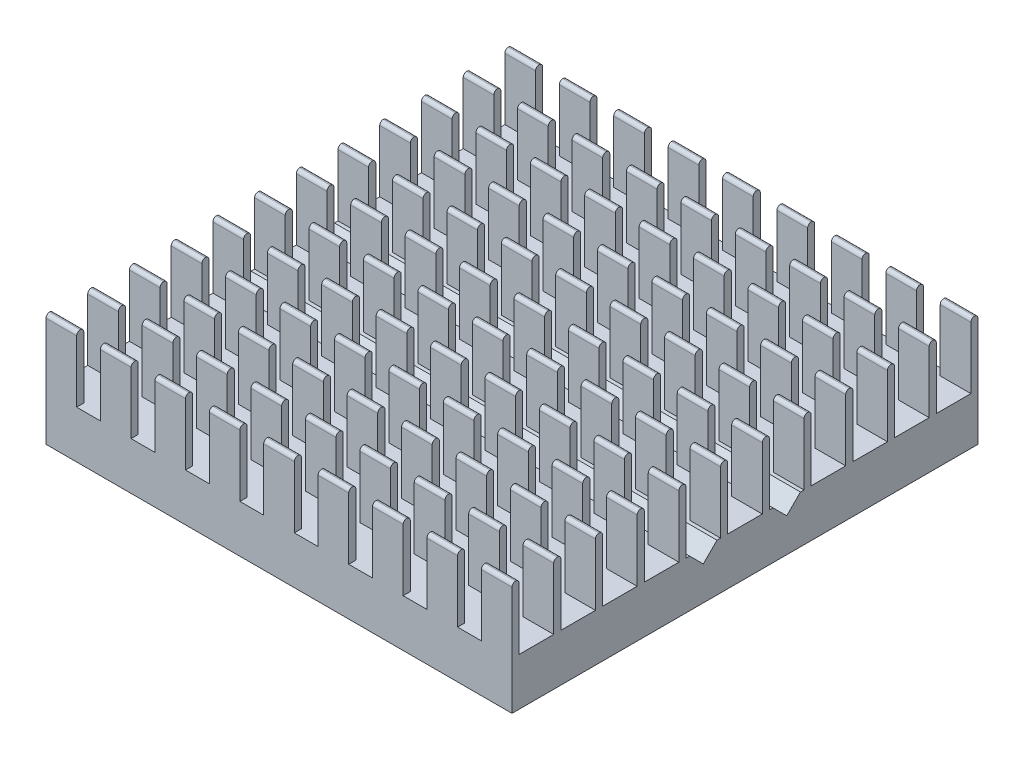
from build123d import *

# Parameters (mm, degrees)
BOSS_EXTRUDE1_START     = -4.75
SKETCH3_W               = 39.25
SKETCH3_H               = 39.25
BOSS_EXTRUDE1_DEPTH     = 4
BOSS_EXTRUDE2_START     = -0.75
SKETCH4_W               = 2.58
SKETCH4_H               = 0.6
BOSS_EXTRUDE2_DEPTH     = 5.5
FILLET1_R               = 0.3
LPATTERN1_START         = -15.04125
LPATTERN1_DEPTH         = 2.58
LPATTERN1_START_2       = -10.4575
LPATTERN1_2_DEPTH       = 2.58
LPATTERN1_START_3       = -5.87375
LPATTERN1_3_DEPTH       = 2.58
LPATTERN1_START_4       = -1.29
LPATTERN1_4_DEPTH       = 2.58
LPATTERN1_START_5       = 3.29375
LPATTERN1_5_DEPTH       = 2.58
LPATTERN1_START_6       = 7.8775
LPATTERN1_6_DEPTH       = 2.58
LPATTERN1_START_7       = 12.46125
LPATTERN1_7_DEPTH       = 2.58
LPATTERN1_START_8       = 17.045
LPATTERN1_8_DEPTH       = 2.58
LPATTERN1_START_9       = -19.625
LPATTERN1_9_DEPTH       = 2.58
CUT_EXTRUDE1_DEPTH      = 29.157481244
CUT_EXTRUDE1_DEPTH_BACK = 29.157481244


# Read off the part's stored shape, not the designer's step: LPattern1
with BuildPart() as part:
    # Sketch3 → Boss-Extrude1 (new body)
    with BuildSketch(Plane(origin=(0, 0, 0), x_dir=(1, 0, 0), z_dir=(0, 1, 0)).offset(BOSS_EXTRUDE1_START)):
        Rectangle(SKETCH3_W, SKETCH3_H)
    extrude(amount=BOSS_EXTRUDE1_DEPTH)

    # Sketch4 → Boss-Extrude2 (add)
    with BuildSketch(Plane(origin=(0, 0, 0), x_dir=(1, 0, 0), z_dir=(0, 1, 0)).offset(BOSS_EXTRUDE2_START)):
        with Locations((-18.335, -19.325)):
            Rectangle(SKETCH4_W, SKETCH4_H)
    extrude(amount=BOSS_EXTRUDE2_DEPTH)

    # Fillet1
    fillet1_edges = [part.edges().sort_by_distance(p)[0] for p in [
        (-18.335, 4.75, 19.025),
        (-18.335, 4.75, 19.625),
    ]]
    fillet(fillet1_edges, radius=FILLET1_R - 0.0001)  # a hair under: the kernel refuses the full size

    # LPattern1 outline → LPattern1 (add)
    with BuildSketch(Plane.YZ.offset(LPATTERN1_START)):
        with BuildLine():
            Line((4.45, -19.025), (-0.75, -19.025))
            Line((-0.75, -19.025), (-0.75, -19.625))
            Line((-0.75, -19.625), (4.45, -19.625))
            ThreePointArc((4.45, -19.625), (4.662132034, -19.537132034), (4.75, -19.325))
            ThreePointArc((4.75, -19.325), (4.662132034, -19.112867966), (4.45, -19.025))
        make_face()
        with BuildLine():
            Line((4.45, -15.511363636), (-0.75, -15.511363636))
            Line((-0.75, -15.511363636), (-0.75, -16.111363636))
            Line((-0.75, -16.111363636), (4.45, -16.111363636))
            ThreePointArc((4.45, -16.111363636), (4.662132034, -16.023495671), (4.75, -15.811363636))
            ThreePointArc((4.75, -15.811363636), (4.662132034, -15.599231602), (4.45, -15.511363636))
        make_face()
        with BuildLine():
            Line((4.45, -11.997727273), (-0.75, -11.997727273))
            Line((-0.75, -11.997727273), (-0.75, -12.597727273))
            Line((-0.75, -12.597727273), (4.45, -12.597727273))
            ThreePointArc((4.45, -12.597727273), (4.662132034, -12.509859307), (4.75, -12.297727273))
            ThreePointArc((4.75, -12.297727273), (4.662132034, -12.085595238), (4.45, -11.997727273))
        make_face()
        with BuildLine():
            Line((4.45, -8.484090909), (-0.75, -8.484090909))
            Line((-0.75, -8.484090909), (-0.75, -9.084090909))
            Line((-0.75, -9.084090909), (4.45, -9.084090909))
            ThreePointArc((4.45, -9.084090909), (4.662132034, -8.996222943), (4.75, -8.784090909))
            ThreePointArc((4.75, -8.784090909), (4.662132034, -8.571958875), (4.45, -8.484090909))
        make_face()
        with BuildLine():
            Line((4.45, -4.970454545), (-0.75, -4.970454545))
            Line((-0.75, -4.970454545), (-0.75, -5.570454545))
            Line((-0.75, -5.570454545), (4.45, -5.570454545))
            ThreePointArc((4.45, -5.570454545), (4.662132034, -5.482586579), (4.75, -5.270454545))
            ThreePointArc((4.75, -5.270454545), (4.662132034, -5.058322511), (4.45, -4.970454545))
        make_face()
        with BuildLine():
            Line((4.45, -1.456818182), (-0.75, -1.456818182))
            Line((-0.75, -1.456818182), (-0.75, -2.056818182))
            Line((-0.75, -2.056818182), (4.45, -2.056818182))
            ThreePointArc((4.45, -2.056818182), (4.662132034, -1.968950216), (4.75, -1.756818182))
            ThreePointArc((4.75, -1.756818182), (4.662132034, -1.544686147), (4.45, -1.456818182))
        make_face()
        with BuildLine():
            Line((4.45, 2.056818182), (-0.75, 2.056818182))
            Line((-0.75, 2.056818182), (-0.75, 1.456818182))
            Line((-0.75, 1.456818182), (4.45, 1.456818182))
            ThreePointArc((4.45, 1.456818182), (4.662132034, 1.544686147), (4.75, 1.756818182))
            ThreePointArc((4.75, 1.756818182), (4.662132034, 1.968950216), (4.45, 2.056818182))
        make_face()
        with BuildLine():
            Line((4.45, 5.570454545), (-0.75, 5.570454545))
            Line((-0.75, 5.570454545), (-0.75, 4.970454545))
            Line((-0.75, 4.970454545), (4.45, 4.970454545))
            ThreePointArc((4.45, 4.970454545), (4.662132034, 5.058322511), (4.75, 5.270454545))
            ThreePointArc((4.75, 5.270454545), (4.662132034, 5.482586579), (4.45, 5.570454545))
        make_face()
        with BuildLine():
            Line((4.45, 9.084090909), (-0.75, 9.084090909))
            Line((-0.75, 9.084090909), (-0.75, 8.484090909))
            Line((-0.75, 8.484090909), (4.45, 8.484090909))
            ThreePointArc((4.45, 8.484090909), (4.662132034, 8.571958875), (4.75, 8.784090909))
            ThreePointArc((4.75, 8.784090909), (4.662132034, 8.996222943), (4.45, 9.084090909))
        make_face()
        with BuildLine():
            Line((4.45, 12.597727273), (-0.75, 12.597727273))
            Line((-0.75, 12.597727273), (-0.75, 11.997727273))
            Line((-0.75, 11.997727273), (4.45, 11.997727273))
            ThreePointArc((4.45, 11.997727273), (4.662132034, 12.085595238), (4.75, 12.297727273))
            ThreePointArc((4.75, 12.297727273), (4.662132034, 12.509859307), (4.45, 12.597727273))
        make_face()
        with BuildLine():
            Line((4.45, 16.111363636), (-0.75, 16.111363636))
            Line((-0.75, 16.111363636), (-0.75, 15.511363636))
            Line((-0.75, 15.511363636), (4.45, 15.511363636))
            ThreePointArc((4.45, 15.511363636), (4.662132034, 15.599231602), (4.75, 15.811363636))
            ThreePointArc((4.75, 15.811363636), (4.662132034, 16.023495671), (4.45, 16.111363636))
        make_face()
        with BuildLine():
            Line((4.45, 19.625), (-0.75, 19.625))
            Line((-0.75, 19.625), (-0.75, 19.025))
            Line((-0.75, 19.025), (4.45, 19.025))
            ThreePointArc((4.45, 19.025), (4.662132034, 19.112867966), (4.75, 19.325))
            ThreePointArc((4.75, 19.325), (4.662132034, 19.537132034), (4.45, 19.625))
        make_face()
    extrude(amount=LPATTERN1_DEPTH)

    # LPattern1 2 outline → LPattern1 2 (add)
    with BuildSketch(Plane.YZ.offset(LPATTERN1_START_2)):
        with BuildLine():
            Line((4.45, -19.025), (-0.75, -19.025))
            Line((-0.75, -19.025), (-0.75, -19.625))
            Line((-0.75, -19.625), (4.45, -19.625))
            ThreePointArc((4.45, -19.625), (4.662132034, -19.537132034), (4.75, -19.325))
            ThreePointArc((4.75, -19.325), (4.662132034, -19.112867966), (4.45, -19.025))
        make_face()
        with BuildLine():
            Line((4.45, -15.511363636), (-0.75, -15.511363636))
            Line((-0.75, -15.511363636), (-0.75, -16.111363636))
            Line((-0.75, -16.111363636), (4.45, -16.111363636))
            ThreePointArc((4.45, -16.111363636), (4.662132034, -16.023495671), (4.75, -15.811363636))
            ThreePointArc((4.75, -15.811363636), (4.662132034, -15.599231602), (4.45, -15.511363636))
        make_face()
        with BuildLine():
            Line((4.45, -11.997727273), (-0.75, -11.997727273))
            Line((-0.75, -11.997727273), (-0.75, -12.597727273))
            Line((-0.75, -12.597727273), (4.45, -12.597727273))
            ThreePointArc((4.45, -12.597727273), (4.662132034, -12.509859307), (4.75, -12.297727273))
            ThreePointArc((4.75, -12.297727273), (4.662132034, -12.085595238), (4.45, -11.997727273))
        make_face()
        with BuildLine():
            Line((4.45, -8.484090909), (-0.75, -8.484090909))
            Line((-0.75, -8.484090909), (-0.75, -9.084090909))
            Line((-0.75, -9.084090909), (4.45, -9.084090909))
            ThreePointArc((4.45, -9.084090909), (4.662132034, -8.996222943), (4.75, -8.784090909))
            ThreePointArc((4.75, -8.784090909), (4.662132034, -8.571958875), (4.45, -8.484090909))
        make_face()
        with BuildLine():
            Line((4.45, -4.970454545), (-0.75, -4.970454545))
            Line((-0.75, -4.970454545), (-0.75, -5.570454545))
            Line((-0.75, -5.570454545), (4.45, -5.570454545))
            ThreePointArc((4.45, -5.570454545), (4.662132034, -5.482586579), (4.75, -5.270454545))
            ThreePointArc((4.75, -5.270454545), (4.662132034, -5.058322511), (4.45, -4.970454545))
        make_face()
        with BuildLine():
            Line((4.45, -1.456818182), (-0.75, -1.456818182))
            Line((-0.75, -1.456818182), (-0.75, -2.056818182))
            Line((-0.75, -2.056818182), (4.45, -2.056818182))
            ThreePointArc((4.45, -2.056818182), (4.662132034, -1.968950216), (4.75, -1.756818182))
            ThreePointArc((4.75, -1.756818182), (4.662132034, -1.544686147), (4.45, -1.456818182))
        make_face()
        with BuildLine():
            Line((4.45, 2.056818182), (-0.75, 2.056818182))
            Line((-0.75, 2.056818182), (-0.75, 1.456818182))
            Line((-0.75, 1.456818182), (4.45, 1.456818182))
            ThreePointArc((4.45, 1.456818182), (4.662132034, 1.544686147), (4.75, 1.756818182))
            ThreePointArc((4.75, 1.756818182), (4.662132034, 1.968950216), (4.45, 2.056818182))
        make_face()
        with BuildLine():
            Line((4.45, 5.570454545), (-0.75, 5.570454545))
            Line((-0.75, 5.570454545), (-0.75, 4.970454545))
            Line((-0.75, 4.970454545), (4.45, 4.970454545))
            ThreePointArc((4.45, 4.970454545), (4.662132034, 5.058322511), (4.75, 5.270454545))
            ThreePointArc((4.75, 5.270454545), (4.662132034, 5.482586579), (4.45, 5.570454545))
        make_face()
        with BuildLine():
            Line((4.45, 9.084090909), (-0.75, 9.084090909))
            Line((-0.75, 9.084090909), (-0.75, 8.484090909))
            Line((-0.75, 8.484090909), (4.45, 8.484090909))
            ThreePointArc((4.45, 8.484090909), (4.662132034, 8.571958875), (4.75, 8.784090909))
            ThreePointArc((4.75, 8.784090909), (4.662132034, 8.996222943), (4.45, 9.084090909))
        make_face()
        with BuildLine():
            Line((4.45, 12.597727273), (-0.75, 12.597727273))
            Line((-0.75, 12.597727273), (-0.75, 11.997727273))
            Line((-0.75, 11.997727273), (4.45, 11.997727273))
            ThreePointArc((4.45, 11.997727273), (4.662132034, 12.085595238), (4.75, 12.297727273))
            ThreePointArc((4.75, 12.297727273), (4.662132034, 12.509859307), (4.45, 12.597727273))
        make_face()
        with BuildLine():
            Line((4.45, 16.111363636), (-0.75, 16.111363636))
            Line((-0.75, 16.111363636), (-0.75, 15.511363636))
            Line((-0.75, 15.511363636), (4.45, 15.511363636))
            ThreePointArc((4.45, 15.511363636), (4.662132034, 15.599231602), (4.75, 15.811363636))
            ThreePointArc((4.75, 15.811363636), (4.662132034, 16.023495671), (4.45, 16.111363636))
        make_face()
        with BuildLine():
            Line((4.45, 19.625), (-0.75, 19.625))
            Line((-0.75, 19.625), (-0.75, 19.025))
            Line((-0.75, 19.025), (4.45, 19.025))
            ThreePointArc((4.45, 19.025), (4.662132034, 19.112867966), (4.75, 19.325))
            ThreePointArc((4.75, 19.325), (4.662132034, 19.537132034), (4.45, 19.625))
        make_face()
    extrude(amount=LPATTERN1_2_DEPTH)

    # LPattern1 3 outline → LPattern1 3 (add)
    with BuildSketch(Plane.YZ.offset(LPATTERN1_START_3)):
        with BuildLine():
            Line((4.45, -19.025), (-0.75, -19.025))
            Line((-0.75, -19.025), (-0.75, -19.625))
            Line((-0.75, -19.625), (4.45, -19.625))
            ThreePointArc((4.45, -19.625), (4.662132034, -19.537132034), (4.75, -19.325))
            ThreePointArc((4.75, -19.325), (4.662132034, -19.112867966), (4.45, -19.025))
        make_face()
        with BuildLine():
            Line((4.45, -15.511363636), (-0.75, -15.511363636))
            Line((-0.75, -15.511363636), (-0.75, -16.111363636))
            Line((-0.75, -16.111363636), (4.45, -16.111363636))
            ThreePointArc((4.45, -16.111363636), (4.662132034, -16.023495671), (4.75, -15.811363636))
            ThreePointArc((4.75, -15.811363636), (4.662132034, -15.599231602), (4.45, -15.511363636))
        make_face()
        with BuildLine():
            Line((4.45, -11.997727273), (-0.75, -11.997727273))
            Line((-0.75, -11.997727273), (-0.75, -12.597727273))
            Line((-0.75, -12.597727273), (4.45, -12.597727273))
            ThreePointArc((4.45, -12.597727273), (4.662132034, -12.509859307), (4.75, -12.297727273))
            ThreePointArc((4.75, -12.297727273), (4.662132034, -12.085595238), (4.45, -11.997727273))
        make_face()
        with BuildLine():
            Line((4.45, -8.484090909), (-0.75, -8.484090909))
            Line((-0.75, -8.484090909), (-0.75, -9.084090909))
            Line((-0.75, -9.084090909), (4.45, -9.084090909))
            ThreePointArc((4.45, -9.084090909), (4.662132034, -8.996222943), (4.75, -8.784090909))
            ThreePointArc((4.75, -8.784090909), (4.662132034, -8.571958875), (4.45, -8.484090909))
        make_face()
        with BuildLine():
            Line((4.45, -4.970454545), (-0.75, -4.970454545))
            Line((-0.75, -4.970454545), (-0.75, -5.570454545))
            Line((-0.75, -5.570454545), (4.45, -5.570454545))
            ThreePointArc((4.45, -5.570454545), (4.662132034, -5.482586579), (4.75, -5.270454545))
            ThreePointArc((4.75, -5.270454545), (4.662132034, -5.058322511), (4.45, -4.970454545))
        make_face()
        with BuildLine():
            Line((4.45, -1.456818182), (-0.75, -1.456818182))
            Line((-0.75, -1.456818182), (-0.75, -2.056818182))
            Line((-0.75, -2.056818182), (4.45, -2.056818182))
            ThreePointArc((4.45, -2.056818182), (4.662132034, -1.968950216), (4.75, -1.756818182))
            ThreePointArc((4.75, -1.756818182), (4.662132034, -1.544686147), (4.45, -1.456818182))
        make_face()
        with BuildLine():
            Line((4.45, 2.056818182), (-0.75, 2.056818182))
            Line((-0.75, 2.056818182), (-0.75, 1.456818182))
            Line((-0.75, 1.456818182), (4.45, 1.456818182))
            ThreePointArc((4.45, 1.456818182), (4.662132034, 1.544686147), (4.75, 1.756818182))
            ThreePointArc((4.75, 1.756818182), (4.662132034, 1.968950216), (4.45, 2.056818182))
        make_face()
        with BuildLine():
            Line((4.45, 5.570454545), (-0.75, 5.570454545))
            Line((-0.75, 5.570454545), (-0.75, 4.970454545))
            Line((-0.75, 4.970454545), (4.45, 4.970454545))
            ThreePointArc((4.45, 4.970454545), (4.662132034, 5.058322511), (4.75, 5.270454545))
            ThreePointArc((4.75, 5.270454545), (4.662132034, 5.482586579), (4.45, 5.570454545))
        make_face()
        with BuildLine():
            Line((4.45, 9.084090909), (-0.75, 9.084090909))
            Line((-0.75, 9.084090909), (-0.75, 8.484090909))
            Line((-0.75, 8.484090909), (4.45, 8.484090909))
            ThreePointArc((4.45, 8.484090909), (4.662132034, 8.571958875), (4.75, 8.784090909))
            ThreePointArc((4.75, 8.784090909), (4.662132034, 8.996222943), (4.45, 9.084090909))
        make_face()
        with BuildLine():
            Line((4.45, 12.597727273), (-0.75, 12.597727273))
            Line((-0.75, 12.597727273), (-0.75, 11.997727273))
            Line((-0.75, 11.997727273), (4.45, 11.997727273))
            ThreePointArc((4.45, 11.997727273), (4.662132034, 12.085595238), (4.75, 12.297727273))
            ThreePointArc((4.75, 12.297727273), (4.662132034, 12.509859307), (4.45, 12.597727273))
        make_face()
        with BuildLine():
            Line((4.45, 16.111363636), (-0.75, 16.111363636))
            Line((-0.75, 16.111363636), (-0.75, 15.511363636))
            Line((-0.75, 15.511363636), (4.45, 15.511363636))
            ThreePointArc((4.45, 15.511363636), (4.662132034, 15.599231602), (4.75, 15.811363636))
            ThreePointArc((4.75, 15.811363636), (4.662132034, 16.023495671), (4.45, 16.111363636))
        make_face()
        with BuildLine():
            Line((4.45, 19.625), (-0.75, 19.625))
            Line((-0.75, 19.625), (-0.75, 19.025))
            Line((-0.75, 19.025), (4.45, 19.025))
            ThreePointArc((4.45, 19.025), (4.662132034, 19.112867966), (4.75, 19.325))
            ThreePointArc((4.75, 19.325), (4.662132034, 19.537132034), (4.45, 19.625))
        make_face()
    extrude(amount=LPATTERN1_3_DEPTH)

    # LPattern1 4 outline → LPattern1 4 (add)
    with BuildSketch(Plane.YZ.offset(LPATTERN1_START_4)):
        with BuildLine():
            Line((4.45, -19.025), (-0.75, -19.025))
            Line((-0.75, -19.025), (-0.75, -19.625))
            Line((-0.75, -19.625), (4.45, -19.625))
            ThreePointArc((4.45, -19.625), (4.662132034, -19.537132034), (4.75, -19.325))
            ThreePointArc((4.75, -19.325), (4.662132034, -19.112867966), (4.45, -19.025))
        make_face()
        with BuildLine():
            Line((4.45, -15.511363636), (-0.75, -15.511363636))
            Line((-0.75, -15.511363636), (-0.75, -16.111363636))
            Line((-0.75, -16.111363636), (4.45, -16.111363636))
            ThreePointArc((4.45, -16.111363636), (4.662132034, -16.023495671), (4.75, -15.811363636))
            ThreePointArc((4.75, -15.811363636), (4.662132034, -15.599231602), (4.45, -15.511363636))
        make_face()
        with BuildLine():
            Line((4.45, -11.997727273), (-0.75, -11.997727273))
            Line((-0.75, -11.997727273), (-0.75, -12.597727273))
            Line((-0.75, -12.597727273), (4.45, -12.597727273))
            ThreePointArc((4.45, -12.597727273), (4.662132034, -12.509859307), (4.75, -12.297727273))
            ThreePointArc((4.75, -12.297727273), (4.662132034, -12.085595238), (4.45, -11.997727273))
        make_face()
        with BuildLine():
            Line((4.45, -8.484090909), (-0.75, -8.484090909))
            Line((-0.75, -8.484090909), (-0.75, -9.084090909))
            Line((-0.75, -9.084090909), (4.45, -9.084090909))
            ThreePointArc((4.45, -9.084090909), (4.662132034, -8.996222943), (4.75, -8.784090909))
            ThreePointArc((4.75, -8.784090909), (4.662132034, -8.571958875), (4.45, -8.484090909))
        make_face()
        with BuildLine():
            Line((4.45, -4.970454545), (-0.75, -4.970454545))
            Line((-0.75, -4.970454545), (-0.75, -5.570454545))
            Line((-0.75, -5.570454545), (4.45, -5.570454545))
            ThreePointArc((4.45, -5.570454545), (4.662132034, -5.482586579), (4.75, -5.270454545))
            ThreePointArc((4.75, -5.270454545), (4.662132034, -5.058322511), (4.45, -4.970454545))
        make_face()
        with BuildLine():
            Line((4.45, -1.456818182), (-0.75, -1.456818182))
            Line((-0.75, -1.456818182), (-0.75, -2.056818182))
            Line((-0.75, -2.056818182), (4.45, -2.056818182))
            ThreePointArc((4.45, -2.056818182), (4.662132034, -1.968950216), (4.75, -1.756818182))
            ThreePointArc((4.75, -1.756818182), (4.662132034, -1.544686147), (4.45, -1.456818182))
        make_face()
        with BuildLine():
            Line((4.45, 2.056818182), (-0.75, 2.056818182))
            Line((-0.75, 2.056818182), (-0.75, 1.456818182))
            Line((-0.75, 1.456818182), (4.45, 1.456818182))
            ThreePointArc((4.45, 1.456818182), (4.662132034, 1.544686147), (4.75, 1.756818182))
            ThreePointArc((4.75, 1.756818182), (4.662132034, 1.968950216), (4.45, 2.056818182))
        make_face()
        with BuildLine():
            Line((4.45, 5.570454545), (-0.75, 5.570454545))
            Line((-0.75, 5.570454545), (-0.75, 4.970454545))
            Line((-0.75, 4.970454545), (4.45, 4.970454545))
            ThreePointArc((4.45, 4.970454545), (4.662132034, 5.058322511), (4.75, 5.270454545))
            ThreePointArc((4.75, 5.270454545), (4.662132034, 5.482586579), (4.45, 5.570454545))
        make_face()
        with BuildLine():
            Line((4.45, 9.084090909), (-0.75, 9.084090909))
            Line((-0.75, 9.084090909), (-0.75, 8.484090909))
            Line((-0.75, 8.484090909), (4.45, 8.484090909))
            ThreePointArc((4.45, 8.484090909), (4.662132034, 8.571958875), (4.75, 8.784090909))
            ThreePointArc((4.75, 8.784090909), (4.662132034, 8.996222943), (4.45, 9.084090909))
        make_face()
        with BuildLine():
            Line((4.45, 12.597727273), (-0.75, 12.597727273))
            Line((-0.75, 12.597727273), (-0.75, 11.997727273))
            Line((-0.75, 11.997727273), (4.45, 11.997727273))
            ThreePointArc((4.45, 11.997727273), (4.662132034, 12.085595238), (4.75, 12.297727273))
            ThreePointArc((4.75, 12.297727273), (4.662132034, 12.509859307), (4.45, 12.597727273))
        make_face()
        with BuildLine():
            Line((4.45, 16.111363636), (-0.75, 16.111363636))
            Line((-0.75, 16.111363636), (-0.75, 15.511363636))
            Line((-0.75, 15.511363636), (4.45, 15.511363636))
            ThreePointArc((4.45, 15.511363636), (4.662132034, 15.599231602), (4.75, 15.811363636))
            ThreePointArc((4.75, 15.811363636), (4.662132034, 16.023495671), (4.45, 16.111363636))
        make_face()
        with BuildLine():
            Line((4.45, 19.625), (-0.75, 19.625))
            Line((-0.75, 19.625), (-0.75, 19.025))
            Line((-0.75, 19.025), (4.45, 19.025))
            ThreePointArc((4.45, 19.025), (4.662132034, 19.112867966), (4.75, 19.325))
            ThreePointArc((4.75, 19.325), (4.662132034, 19.537132034), (4.45, 19.625))
        make_face()
    extrude(amount=LPATTERN1_4_DEPTH)

    # LPattern1 5 outline → LPattern1 5 (add)
    with BuildSketch(Plane.YZ.offset(LPATTERN1_START_5)):
        with BuildLine():
            Line((4.45, -19.025), (-0.75, -19.025))
            Line((-0.75, -19.025), (-0.75, -19.625))
            Line((-0.75, -19.625), (4.45, -19.625))
            ThreePointArc((4.45, -19.625), (4.662132034, -19.537132034), (4.75, -19.325))
            ThreePointArc((4.75, -19.325), (4.662132034, -19.112867966), (4.45, -19.025))
        make_face()
        with BuildLine():
            Line((4.45, -15.511363636), (-0.75, -15.511363636))
            Line((-0.75, -15.511363636), (-0.75, -16.111363636))
            Line((-0.75, -16.111363636), (4.45, -16.111363636))
            ThreePointArc((4.45, -16.111363636), (4.662132034, -16.023495671), (4.75, -15.811363636))
            ThreePointArc((4.75, -15.811363636), (4.662132034, -15.599231602), (4.45, -15.511363636))
        make_face()
        with BuildLine():
            Line((4.45, -11.997727273), (-0.75, -11.997727273))
            Line((-0.75, -11.997727273), (-0.75, -12.597727273))
            Line((-0.75, -12.597727273), (4.45, -12.597727273))
            ThreePointArc((4.45, -12.597727273), (4.662132034, -12.509859307), (4.75, -12.297727273))
            ThreePointArc((4.75, -12.297727273), (4.662132034, -12.085595238), (4.45, -11.997727273))
        make_face()
        with BuildLine():
            Line((4.45, -8.484090909), (-0.75, -8.484090909))
            Line((-0.75, -8.484090909), (-0.75, -9.084090909))
            Line((-0.75, -9.084090909), (4.45, -9.084090909))
            ThreePointArc((4.45, -9.084090909), (4.662132034, -8.996222943), (4.75, -8.784090909))
            ThreePointArc((4.75, -8.784090909), (4.662132034, -8.571958875), (4.45, -8.484090909))
        make_face()
        with BuildLine():
            Line((4.45, -4.970454545), (-0.75, -4.970454545))
            Line((-0.75, -4.970454545), (-0.75, -5.570454545))
            Line((-0.75, -5.570454545), (4.45, -5.570454545))
            ThreePointArc((4.45, -5.570454545), (4.662132034, -5.482586579), (4.75, -5.270454545))
            ThreePointArc((4.75, -5.270454545), (4.662132034, -5.058322511), (4.45, -4.970454545))
        make_face()
        with BuildLine():
            Line((4.45, -1.456818182), (-0.75, -1.456818182))
            Line((-0.75, -1.456818182), (-0.75, -2.056818182))
            Line((-0.75, -2.056818182), (4.45, -2.056818182))
            ThreePointArc((4.45, -2.056818182), (4.662132034, -1.968950216), (4.75, -1.756818182))
            ThreePointArc((4.75, -1.756818182), (4.662132034, -1.544686147), (4.45, -1.456818182))
        make_face()
        with BuildLine():
            Line((4.45, 2.056818182), (-0.75, 2.056818182))
            Line((-0.75, 2.056818182), (-0.75, 1.456818182))
            Line((-0.75, 1.456818182), (4.45, 1.456818182))
            ThreePointArc((4.45, 1.456818182), (4.662132034, 1.544686147), (4.75, 1.756818182))
            ThreePointArc((4.75, 1.756818182), (4.662132034, 1.968950216), (4.45, 2.056818182))
        make_face()
        with BuildLine():
            Line((4.45, 5.570454545), (-0.75, 5.570454545))
            Line((-0.75, 5.570454545), (-0.75, 4.970454545))
            Line((-0.75, 4.970454545), (4.45, 4.970454545))
            ThreePointArc((4.45, 4.970454545), (4.662132034, 5.058322511), (4.75, 5.270454545))
            ThreePointArc((4.75, 5.270454545), (4.662132034, 5.482586579), (4.45, 5.570454545))
        make_face()
        with BuildLine():
            Line((4.45, 9.084090909), (-0.75, 9.084090909))
            Line((-0.75, 9.084090909), (-0.75, 8.484090909))
            Line((-0.75, 8.484090909), (4.45, 8.484090909))
            ThreePointArc((4.45, 8.484090909), (4.662132034, 8.571958875), (4.75, 8.784090909))
            ThreePointArc((4.75, 8.784090909), (4.662132034, 8.996222943), (4.45, 9.084090909))
        make_face()
        with BuildLine():
            Line((4.45, 12.597727273), (-0.75, 12.597727273))
            Line((-0.75, 12.597727273), (-0.75, 11.997727273))
            Line((-0.75, 11.997727273), (4.45, 11.997727273))
            ThreePointArc((4.45, 11.997727273), (4.662132034, 12.085595238), (4.75, 12.297727273))
            ThreePointArc((4.75, 12.297727273), (4.662132034, 12.509859307), (4.45, 12.597727273))
        make_face()
        with BuildLine():
            Line((4.45, 16.111363636), (-0.75, 16.111363636))
            Line((-0.75, 16.111363636), (-0.75, 15.511363636))
            Line((-0.75, 15.511363636), (4.45, 15.511363636))
            ThreePointArc((4.45, 15.511363636), (4.662132034, 15.599231602), (4.75, 15.811363636))
            ThreePointArc((4.75, 15.811363636), (4.662132034, 16.023495671), (4.45, 16.111363636))
        make_face()
        with BuildLine():
            Line((4.45, 19.625), (-0.75, 19.625))
            Line((-0.75, 19.625), (-0.75, 19.025))
            Line((-0.75, 19.025), (4.45, 19.025))
            ThreePointArc((4.45, 19.025), (4.662132034, 19.112867966), (4.75, 19.325))
            ThreePointArc((4.75, 19.325), (4.662132034, 19.537132034), (4.45, 19.625))
        make_face()
    extrude(amount=LPATTERN1_5_DEPTH)

    # LPattern1 6 outline → LPattern1 6 (add)
    with BuildSketch(Plane.YZ.offset(LPATTERN1_START_6)):
        with BuildLine():
            Line((4.45, -19.025), (-0.75, -19.025))
            Line((-0.75, -19.025), (-0.75, -19.625))
            Line((-0.75, -19.625), (4.45, -19.625))
            ThreePointArc((4.45, -19.625), (4.662132034, -19.537132034), (4.75, -19.325))
            ThreePointArc((4.75, -19.325), (4.662132034, -19.112867966), (4.45, -19.025))
        make_face()
        with BuildLine():
            Line((4.45, -15.511363636), (-0.75, -15.511363636))
            Line((-0.75, -15.511363636), (-0.75, -16.111363636))
            Line((-0.75, -16.111363636), (4.45, -16.111363636))
            ThreePointArc((4.45, -16.111363636), (4.662132034, -16.023495671), (4.75, -15.811363636))
            ThreePointArc((4.75, -15.811363636), (4.662132034, -15.599231602), (4.45, -15.511363636))
        make_face()
        with BuildLine():
            Line((4.45, -11.997727273), (-0.75, -11.997727273))
            Line((-0.75, -11.997727273), (-0.75, -12.597727273))
            Line((-0.75, -12.597727273), (4.45, -12.597727273))
            ThreePointArc((4.45, -12.597727273), (4.662132034, -12.509859307), (4.75, -12.297727273))
            ThreePointArc((4.75, -12.297727273), (4.662132034, -12.085595238), (4.45, -11.997727273))
        make_face()
        with BuildLine():
            Line((4.45, -8.484090909), (-0.75, -8.484090909))
            Line((-0.75, -8.484090909), (-0.75, -9.084090909))
            Line((-0.75, -9.084090909), (4.45, -9.084090909))
            ThreePointArc((4.45, -9.084090909), (4.662132034, -8.996222943), (4.75, -8.784090909))
            ThreePointArc((4.75, -8.784090909), (4.662132034, -8.571958875), (4.45, -8.484090909))
        make_face()
        with BuildLine():
            Line((4.45, -4.970454545), (-0.75, -4.970454545))
            Line((-0.75, -4.970454545), (-0.75, -5.570454545))
            Line((-0.75, -5.570454545), (4.45, -5.570454545))
            ThreePointArc((4.45, -5.570454545), (4.662132034, -5.482586579), (4.75, -5.270454545))
            ThreePointArc((4.75, -5.270454545), (4.662132034, -5.058322511), (4.45, -4.970454545))
        make_face()
        with BuildLine():
            Line((4.45, -1.456818182), (-0.75, -1.456818182))
            Line((-0.75, -1.456818182), (-0.75, -2.056818182))
            Line((-0.75, -2.056818182), (4.45, -2.056818182))
            ThreePointArc((4.45, -2.056818182), (4.662132034, -1.968950216), (4.75, -1.756818182))
            ThreePointArc((4.75, -1.756818182), (4.662132034, -1.544686147), (4.45, -1.456818182))
        make_face()
        with BuildLine():
            Line((4.45, 2.056818182), (-0.75, 2.056818182))
            Line((-0.75, 2.056818182), (-0.75, 1.456818182))
            Line((-0.75, 1.456818182), (4.45, 1.456818182))
            ThreePointArc((4.45, 1.456818182), (4.662132034, 1.544686147), (4.75, 1.756818182))
            ThreePointArc((4.75, 1.756818182), (4.662132034, 1.968950216), (4.45, 2.056818182))
        make_face()
        with BuildLine():
            Line((4.45, 5.570454545), (-0.75, 5.570454545))
            Line((-0.75, 5.570454545), (-0.75, 4.970454545))
            Line((-0.75, 4.970454545), (4.45, 4.970454545))
            ThreePointArc((4.45, 4.970454545), (4.662132034, 5.058322511), (4.75, 5.270454545))
            ThreePointArc((4.75, 5.270454545), (4.662132034, 5.482586579), (4.45, 5.570454545))
        make_face()
        with BuildLine():
            Line((4.45, 9.084090909), (-0.75, 9.084090909))
            Line((-0.75, 9.084090909), (-0.75, 8.484090909))
            Line((-0.75, 8.484090909), (4.45, 8.484090909))
            ThreePointArc((4.45, 8.484090909), (4.662132034, 8.571958875), (4.75, 8.784090909))
            ThreePointArc((4.75, 8.784090909), (4.662132034, 8.996222943), (4.45, 9.084090909))
        make_face()
        with BuildLine():
            Line((4.45, 12.597727273), (-0.75, 12.597727273))
            Line((-0.75, 12.597727273), (-0.75, 11.997727273))
            Line((-0.75, 11.997727273), (4.45, 11.997727273))
            ThreePointArc((4.45, 11.997727273), (4.662132034, 12.085595238), (4.75, 12.297727273))
            ThreePointArc((4.75, 12.297727273), (4.662132034, 12.509859307), (4.45, 12.597727273))
        make_face()
        with BuildLine():
            Line((4.45, 16.111363636), (-0.75, 16.111363636))
            Line((-0.75, 16.111363636), (-0.75, 15.511363636))
            Line((-0.75, 15.511363636), (4.45, 15.511363636))
            ThreePointArc((4.45, 15.511363636), (4.662132034, 15.599231602), (4.75, 15.811363636))
            ThreePointArc((4.75, 15.811363636), (4.662132034, 16.023495671), (4.45, 16.111363636))
        make_face()
        with BuildLine():
            Line((4.45, 19.625), (-0.75, 19.625))
            Line((-0.75, 19.625), (-0.75, 19.025))
            Line((-0.75, 19.025), (4.45, 19.025))
            ThreePointArc((4.45, 19.025), (4.662132034, 19.112867966), (4.75, 19.325))
            ThreePointArc((4.75, 19.325), (4.662132034, 19.537132034), (4.45, 19.625))
        make_face()
    extrude(amount=LPATTERN1_6_DEPTH)

    # LPattern1 7 outline → LPattern1 7 (add)
    with BuildSketch(Plane.YZ.offset(LPATTERN1_START_7)):
        with BuildLine():
            Line((4.45, -19.025), (-0.75, -19.025))
            Line((-0.75, -19.025), (-0.75, -19.625))
            Line((-0.75, -19.625), (4.45, -19.625))
            ThreePointArc((4.45, -19.625), (4.662132034, -19.537132034), (4.75, -19.325))
            ThreePointArc((4.75, -19.325), (4.662132034, -19.112867966), (4.45, -19.025))
        make_face()
        with BuildLine():
            Line((4.45, -15.511363636), (-0.75, -15.511363636))
            Line((-0.75, -15.511363636), (-0.75, -16.111363636))
            Line((-0.75, -16.111363636), (4.45, -16.111363636))
            ThreePointArc((4.45, -16.111363636), (4.662132034, -16.023495671), (4.75, -15.811363636))
            ThreePointArc((4.75, -15.811363636), (4.662132034, -15.599231602), (4.45, -15.511363636))
        make_face()
        with BuildLine():
            Line((4.45, -11.997727273), (-0.75, -11.997727273))
            Line((-0.75, -11.997727273), (-0.75, -12.597727273))
            Line((-0.75, -12.597727273), (4.45, -12.597727273))
            ThreePointArc((4.45, -12.597727273), (4.662132034, -12.509859307), (4.75, -12.297727273))
            ThreePointArc((4.75, -12.297727273), (4.662132034, -12.085595238), (4.45, -11.997727273))
        make_face()
        with BuildLine():
            Line((4.45, -8.484090909), (-0.75, -8.484090909))
            Line((-0.75, -8.484090909), (-0.75, -9.084090909))
            Line((-0.75, -9.084090909), (4.45, -9.084090909))
            ThreePointArc((4.45, -9.084090909), (4.662132034, -8.996222943), (4.75, -8.784090909))
            ThreePointArc((4.75, -8.784090909), (4.662132034, -8.571958875), (4.45, -8.484090909))
        make_face()
        with BuildLine():
            Line((4.45, -4.970454545), (-0.75, -4.970454545))
            Line((-0.75, -4.970454545), (-0.75, -5.570454545))
            Line((-0.75, -5.570454545), (4.45, -5.570454545))
            ThreePointArc((4.45, -5.570454545), (4.662132034, -5.482586579), (4.75, -5.270454545))
            ThreePointArc((4.75, -5.270454545), (4.662132034, -5.058322511), (4.45, -4.970454545))
        make_face()
        with BuildLine():
            Line((4.45, -1.456818182), (-0.75, -1.456818182))
            Line((-0.75, -1.456818182), (-0.75, -2.056818182))
            Line((-0.75, -2.056818182), (4.45, -2.056818182))
            ThreePointArc((4.45, -2.056818182), (4.662132034, -1.968950216), (4.75, -1.756818182))
            ThreePointArc((4.75, -1.756818182), (4.662132034, -1.544686147), (4.45, -1.456818182))
        make_face()
        with BuildLine():
            Line((4.45, 2.056818182), (-0.75, 2.056818182))
            Line((-0.75, 2.056818182), (-0.75, 1.456818182))
            Line((-0.75, 1.456818182), (4.45, 1.456818182))
            ThreePointArc((4.45, 1.456818182), (4.662132034, 1.544686147), (4.75, 1.756818182))
            ThreePointArc((4.75, 1.756818182), (4.662132034, 1.968950216), (4.45, 2.056818182))
        make_face()
        with BuildLine():
            Line((4.45, 5.570454545), (-0.75, 5.570454545))
            Line((-0.75, 5.570454545), (-0.75, 4.970454545))
            Line((-0.75, 4.970454545), (4.45, 4.970454545))
            ThreePointArc((4.45, 4.970454545), (4.662132034, 5.058322511), (4.75, 5.270454545))
            ThreePointArc((4.75, 5.270454545), (4.662132034, 5.482586579), (4.45, 5.570454545))
        make_face()
        with BuildLine():
            Line((4.45, 9.084090909), (-0.75, 9.084090909))
            Line((-0.75, 9.084090909), (-0.75, 8.484090909))
            Line((-0.75, 8.484090909), (4.45, 8.484090909))
            ThreePointArc((4.45, 8.484090909), (4.662132034, 8.571958875), (4.75, 8.784090909))
            ThreePointArc((4.75, 8.784090909), (4.662132034, 8.996222943), (4.45, 9.084090909))
        make_face()
        with BuildLine():
            Line((4.45, 12.597727273), (-0.75, 12.597727273))
            Line((-0.75, 12.597727273), (-0.75, 11.997727273))
            Line((-0.75, 11.997727273), (4.45, 11.997727273))
            ThreePointArc((4.45, 11.997727273), (4.662132034, 12.085595238), (4.75, 12.297727273))
            ThreePointArc((4.75, 12.297727273), (4.662132034, 12.509859307), (4.45, 12.597727273))
        make_face()
        with BuildLine():
            Line((4.45, 16.111363636), (-0.75, 16.111363636))
            Line((-0.75, 16.111363636), (-0.75, 15.511363636))
            Line((-0.75, 15.511363636), (4.45, 15.511363636))
            ThreePointArc((4.45, 15.511363636), (4.662132034, 15.599231602), (4.75, 15.811363636))
            ThreePointArc((4.75, 15.811363636), (4.662132034, 16.023495671), (4.45, 16.111363636))
        make_face()
        with BuildLine():
            Line((4.45, 19.625), (-0.75, 19.625))
            Line((-0.75, 19.625), (-0.75, 19.025))
            Line((-0.75, 19.025), (4.45, 19.025))
            ThreePointArc((4.45, 19.025), (4.662132034, 19.112867966), (4.75, 19.325))
            ThreePointArc((4.75, 19.325), (4.662132034, 19.537132034), (4.45, 19.625))
        make_face()
    extrude(amount=LPATTERN1_7_DEPTH)

    # LPattern1 8 outline → LPattern1 8 (add)
    with BuildSketch(Plane.YZ.offset(LPATTERN1_START_8)):
        with BuildLine():
            Line((4.45, -19.025), (-0.75, -19.025))
            Line((-0.75, -19.025), (-0.75, -19.625))
            Line((-0.75, -19.625), (4.45, -19.625))
            ThreePointArc((4.45, -19.625), (4.662132034, -19.537132034), (4.75, -19.325))
            ThreePointArc((4.75, -19.325), (4.662132034, -19.112867966), (4.45, -19.025))
        make_face()
        with BuildLine():
            Line((4.45, -15.511363636), (-0.75, -15.511363636))
            Line((-0.75, -15.511363636), (-0.75, -16.111363636))
            Line((-0.75, -16.111363636), (4.45, -16.111363636))
            ThreePointArc((4.45, -16.111363636), (4.662132034, -16.023495671), (4.75, -15.811363636))
            ThreePointArc((4.75, -15.811363636), (4.662132034, -15.599231602), (4.45, -15.511363636))
        make_face()
        with BuildLine():
            Line((4.45, -11.997727273), (-0.75, -11.997727273))
            Line((-0.75, -11.997727273), (-0.75, -12.597727273))
            Line((-0.75, -12.597727273), (4.45, -12.597727273))
            ThreePointArc((4.45, -12.597727273), (4.662132034, -12.509859307), (4.75, -12.297727273))
            ThreePointArc((4.75, -12.297727273), (4.662132034, -12.085595238), (4.45, -11.997727273))
        make_face()
        with BuildLine():
            Line((4.45, -8.484090909), (-0.75, -8.484090909))
            Line((-0.75, -8.484090909), (-0.75, -9.084090909))
            Line((-0.75, -9.084090909), (4.45, -9.084090909))
            ThreePointArc((4.45, -9.084090909), (4.662132034, -8.996222943), (4.75, -8.784090909))
            ThreePointArc((4.75, -8.784090909), (4.662132034, -8.571958875), (4.45, -8.484090909))
        make_face()
        with BuildLine():
            Line((4.45, -4.970454545), (-0.75, -4.970454545))
            Line((-0.75, -4.970454545), (-0.75, -5.570454545))
            Line((-0.75, -5.570454545), (4.45, -5.570454545))
            ThreePointArc((4.45, -5.570454545), (4.662132034, -5.482586579), (4.75, -5.270454545))
            ThreePointArc((4.75, -5.270454545), (4.662132034, -5.058322511), (4.45, -4.970454545))
        make_face()
        with BuildLine():
            Line((4.45, -1.456818182), (-0.75, -1.456818182))
            Line((-0.75, -1.456818182), (-0.75, -2.056818182))
            Line((-0.75, -2.056818182), (4.45, -2.056818182))
            ThreePointArc((4.45, -2.056818182), (4.662132034, -1.968950216), (4.75, -1.756818182))
            ThreePointArc((4.75, -1.756818182), (4.662132034, -1.544686147), (4.45, -1.456818182))
        make_face()
        with BuildLine():
            Line((4.45, 2.056818182), (-0.75, 2.056818182))
            Line((-0.75, 2.056818182), (-0.75, 1.456818182))
            Line((-0.75, 1.456818182), (4.45, 1.456818182))
            ThreePointArc((4.45, 1.456818182), (4.662132034, 1.544686147), (4.75, 1.756818182))
            ThreePointArc((4.75, 1.756818182), (4.662132034, 1.968950216), (4.45, 2.056818182))
        make_face()
        with BuildLine():
            Line((4.45, 5.570454545), (-0.75, 5.570454545))
            Line((-0.75, 5.570454545), (-0.75, 4.970454545))
            Line((-0.75, 4.970454545), (4.45, 4.970454545))
            ThreePointArc((4.45, 4.970454545), (4.662132034, 5.058322511), (4.75, 5.270454545))
            ThreePointArc((4.75, 5.270454545), (4.662132034, 5.482586579), (4.45, 5.570454545))
        make_face()
        with BuildLine():
            Line((4.45, 9.084090909), (-0.75, 9.084090909))
            Line((-0.75, 9.084090909), (-0.75, 8.484090909))
            Line((-0.75, 8.484090909), (4.45, 8.484090909))
            ThreePointArc((4.45, 8.484090909), (4.662132034, 8.571958875), (4.75, 8.784090909))
            ThreePointArc((4.75, 8.784090909), (4.662132034, 8.996222943), (4.45, 9.084090909))
        make_face()
        with BuildLine():
            Line((4.45, 12.597727273), (-0.75, 12.597727273))
            Line((-0.75, 12.597727273), (-0.75, 11.997727273))
            Line((-0.75, 11.997727273), (4.45, 11.997727273))
            ThreePointArc((4.45, 11.997727273), (4.662132034, 12.085595238), (4.75, 12.297727273))
            ThreePointArc((4.75, 12.297727273), (4.662132034, 12.509859307), (4.45, 12.597727273))
        make_face()
        with BuildLine():
            Line((4.45, 16.111363636), (-0.75, 16.111363636))
            Line((-0.75, 16.111363636), (-0.75, 15.511363636))
            Line((-0.75, 15.511363636), (4.45, 15.511363636))
            ThreePointArc((4.45, 15.511363636), (4.662132034, 15.599231602), (4.75, 15.811363636))
            ThreePointArc((4.75, 15.811363636), (4.662132034, 16.023495671), (4.45, 16.111363636))
        make_face()
        with BuildLine():
            Line((4.45, 19.625), (-0.75, 19.625))
            Line((-0.75, 19.625), (-0.75, 19.025))
            Line((-0.75, 19.025), (4.45, 19.025))
            ThreePointArc((4.45, 19.025), (4.662132034, 19.112867966), (4.75, 19.325))
            ThreePointArc((4.75, 19.325), (4.662132034, 19.537132034), (4.45, 19.625))
        make_face()
    extrude(amount=LPATTERN1_8_DEPTH)

    # LPattern1 9 outline → LPattern1 9 (add)
    with BuildSketch(Plane.YZ.offset(LPATTERN1_START_9)):
        with BuildLine():
            Line((4.45, -19.025), (-0.75, -19.025))
            Line((-0.75, -19.025), (-0.75, -19.625))
            Line((-0.75, -19.625), (4.45, -19.625))
            ThreePointArc((4.45, -19.625), (4.662132034, -19.537132034), (4.75, -19.325))
            ThreePointArc((4.75, -19.325), (4.662132034, -19.112867966), (4.45, -19.025))
        make_face()
        with BuildLine():
            Line((4.45, -15.511363636), (-0.75, -15.511363636))
            Line((-0.75, -15.511363636), (-0.75, -16.111363636))
            Line((-0.75, -16.111363636), (4.45, -16.111363636))
            ThreePointArc((4.45, -16.111363636), (4.662132034, -16.023495671), (4.75, -15.811363636))
            ThreePointArc((4.75, -15.811363636), (4.662132034, -15.599231602), (4.45, -15.511363636))
        make_face()
        with BuildLine():
            Line((4.45, -11.997727273), (-0.75, -11.997727273))
            Line((-0.75, -11.997727273), (-0.75, -12.597727273))
            Line((-0.75, -12.597727273), (4.45, -12.597727273))
            ThreePointArc((4.45, -12.597727273), (4.662132034, -12.509859307), (4.75, -12.297727273))
            ThreePointArc((4.75, -12.297727273), (4.662132034, -12.085595238), (4.45, -11.997727273))
        make_face()
        with BuildLine():
            Line((4.45, -8.484090909), (-0.75, -8.484090909))
            Line((-0.75, -8.484090909), (-0.75, -9.084090909))
            Line((-0.75, -9.084090909), (4.45, -9.084090909))
            ThreePointArc((4.45, -9.084090909), (4.662132034, -8.996222943), (4.75, -8.784090909))
            ThreePointArc((4.75, -8.784090909), (4.662132034, -8.571958875), (4.45, -8.484090909))
        make_face()
        with BuildLine():
            Line((4.45, -4.970454545), (-0.75, -4.970454545))
            Line((-0.75, -4.970454545), (-0.75, -5.570454545))
            Line((-0.75, -5.570454545), (4.45, -5.570454545))
            ThreePointArc((4.45, -5.570454545), (4.662132034, -5.482586579), (4.75, -5.270454545))
            ThreePointArc((4.75, -5.270454545), (4.662132034, -5.058322511), (4.45, -4.970454545))
        make_face()
        with BuildLine():
            Line((4.45, -1.456818182), (-0.75, -1.456818182))
            Line((-0.75, -1.456818182), (-0.75, -2.056818182))
            Line((-0.75, -2.056818182), (4.45, -2.056818182))
            ThreePointArc((4.45, -2.056818182), (4.662132034, -1.968950216), (4.75, -1.756818182))
            ThreePointArc((4.75, -1.756818182), (4.662132034, -1.544686147), (4.45, -1.456818182))
        make_face()
        with BuildLine():
            Line((4.45, 2.056818182), (-0.75, 2.056818182))
            Line((-0.75, 2.056818182), (-0.75, 1.456818182))
            Line((-0.75, 1.456818182), (4.45, 1.456818182))
            ThreePointArc((4.45, 1.456818182), (4.662132034, 1.544686147), (4.75, 1.756818182))
            ThreePointArc((4.75, 1.756818182), (4.662132034, 1.968950216), (4.45, 2.056818182))
        make_face()
        with BuildLine():
            Line((4.45, 5.570454545), (-0.75, 5.570454545))
            Line((-0.75, 5.570454545), (-0.75, 4.970454545))
            Line((-0.75, 4.970454545), (4.45, 4.970454545))
            ThreePointArc((4.45, 4.970454545), (4.662132034, 5.058322511), (4.75, 5.270454545))
            ThreePointArc((4.75, 5.270454545), (4.662132034, 5.482586579), (4.45, 5.570454545))
        make_face()
        with BuildLine():
            Line((4.45, 9.084090909), (-0.75, 9.084090909))
            Line((-0.75, 9.084090909), (-0.75, 8.484090909))
            Line((-0.75, 8.484090909), (4.45, 8.484090909))
            ThreePointArc((4.45, 8.484090909), (4.662132034, 8.571958875), (4.75, 8.784090909))
            ThreePointArc((4.75, 8.784090909), (4.662132034, 8.996222943), (4.45, 9.084090909))
        make_face()
        with BuildLine():
            Line((4.45, 12.597727273), (-0.75, 12.597727273))
            Line((-0.75, 12.597727273), (-0.75, 11.997727273))
            Line((-0.75, 11.997727273), (4.45, 11.997727273))
            ThreePointArc((4.45, 11.997727273), (4.662132034, 12.085595238), (4.75, 12.297727273))
            ThreePointArc((4.75, 12.297727273), (4.662132034, 12.509859307), (4.45, 12.597727273))
        make_face()
        with BuildLine():
            Line((4.45, 16.111363636), (-0.75, 16.111363636))
            Line((-0.75, 16.111363636), (-0.75, 15.511363636))
            Line((-0.75, 15.511363636), (4.45, 15.511363636))
            ThreePointArc((4.45, 15.511363636), (4.662132034, 15.599231602), (4.75, 15.811363636))
            ThreePointArc((4.75, 15.811363636), (4.662132034, 16.023495671), (4.45, 16.111363636))
        make_face()
    extrude(amount=LPATTERN1_9_DEPTH)

    # Sketch5 → Cut-Extrude1 (cut, two sides: drawn at the far end of the back side and taken through both)
    with BuildSketch(Plane(origin=(0, 0, 0), x_dir=(0, 0, -1), z_dir=(1, 0, 0)).offset(-CUT_EXTRUDE1_DEPTH_BACK)):
        Polygon((-4.670454545, -0.75), (-3.513636364, -1.906818182), (-2.356818182, -0.75), align=None)
        Polygon((4.670454545, -0.75), (2.356818182, -0.75), (3.513636364, -1.906818182), align=None)
    extrude(amount=CUT_EXTRUDE1_DEPTH + CUT_EXTRUDE1_DEPTH_BACK, mode=Mode.SUBTRACT)


solid = part.part
